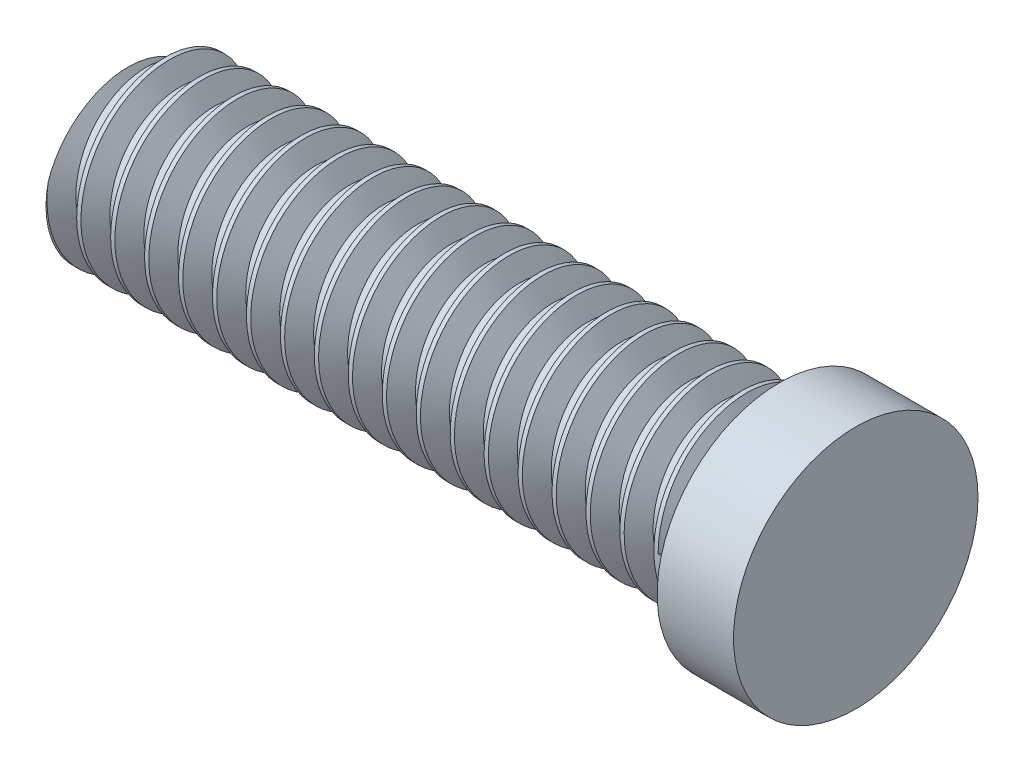
from build123d import *
from build123d.topology import SkipClean

# Parameters (mm, degrees)
SKETCH1_R           = 1.905
BOSS_EXTRUDE1_DEPTH = 13.335
SKETCH2_R           = 2.54
BOSS_EXTRUDE2_DEPTH = 1.5875
THREAD1_PITCH       = 0.705555556


with BuildPart() as part:
    # Sketch1 → Boss-Extrude1 (new body)
    with BuildSketch(Plane(origin=(0, 0, 0), x_dir=(0, 0, -1), z_dir=(1, 0, 0))):
        Circle(SKETCH1_R)
    extrude(amount=BOSS_EXTRUDE1_DEPTH)

    # Sketch2 → Boss-Extrude2 (add)
    with BuildSketch(Plane(origin=(13.335, 0, 0), x_dir=(0, 0, -1), z_dir=(1, 0, 0))):
        Circle(SKETCH2_R)
    extrude(amount=BOSS_EXTRUDE2_DEPTH)

    # Thread1: the profile of Thread Profile1 profile screwed along a right-hand helix of 21.6 turns, 6 arcs to a turn; built about Z, then put on its axis
    with SkipClean():  # the faces are left unmerged after this step: merging them gives an invalid solid
        thread1_z = Axis((0, 0, 0), (0, 0, 1))
        thread1_corners = [(1.9053, 0, -0.000173205), (1.9053, 0, 0.617534314), (1.523106855, 0, 0.396874999), (1.523106855, 0, 0.22048611)]
        with BuildLine(mode=Mode.PRIVATE) as thread1_profile:
            Line(thread1_corners[0], thread1_corners[1])
            Line(thread1_corners[1], thread1_corners[2])
            Line(thread1_corners[2], thread1_corners[3])
            Line(thread1_corners[3], thread1_corners[0])
        thread1_cap = Face(thread1_profile.wire())
        thread1_turn_angles = [0, 30, 60, 90, 120, 150, 180, 210, 240, 270, 300, 330, 360]
        thread1_turn_weights = [1, 0.8660254037844387, 1, 0.8660254037844387, 1, 0.8660254037844387, 1, 0.8660254037844387, 1, 0.8660254037844387, 1, 0.8660254037844387, 1]
        thread1_turn_rails = [Edge.make_bspline([Vector(p[0], p[1], 0).rotate(thread1_z, thread1_turn_angles[k]) / thread1_turn_weights[k] + Vector(0, 0, p[2] + THREAD1_PITCH * thread1_turn_angles[k] / 360) for k in range(13)], [0, 0, 0, 1, 1, 2, 2, 3, 3, 4, 4, 5, 5, 6, 6, 6], 2, thread1_turn_weights) for p in thread1_corners]
        thread1_turn_sides = [Face.make_surface_from_curves(thread1_turn_rails[p[0]], thread1_turn_rails[p[1]]) for p in [(0, 1), (1, 2), (2, 3), (3, 0)]]
        thread1_last_angles = [7560, 7590, 7620, 7650, 7680, 7710, 7740, 7758, 7776]
        thread1_last_weights = [1, 0.8660254037844387, 1, 0.8660254037844387, 1, 0.8660254037844387, 1, 0.9510565162951535, 1]
        thread1_last_rails = [Edge.make_bspline([Vector(p[0], p[1], 0).rotate(thread1_z, thread1_last_angles[k]) / thread1_last_weights[k] + Vector(0, 0, p[2] + THREAD1_PITCH * thread1_last_angles[k] / 360) for k in range(9)], [0, 0, 0, 1, 1, 2, 2, 3, 3, 4, 4, 4], 2, thread1_last_weights) for p in thread1_corners]
        thread1_last_sides = [Face.make_surface_from_curves(thread1_last_rails[p[0]], thread1_last_rails[p[1]]) for p in [(0, 1), (1, 2), (2, 3), (3, 0)]]
        thread1 = Plane(origin=(13.335, 0, 0), x_dir=(0, 0.052335956, 0.998629535), z_dir=(-1, 0, 0)) * Solid(Shell([*[p.moved(Location((0, 0, THREAD1_PITCH * i))) for i in range(21) for p in thread1_turn_sides], *thread1_last_sides, thread1_cap, thread1_cap.rotate(thread1_z, 7776).moved(Location((0, 0, THREAD1_PITCH * 7776 / 360)))]))
        add(thread1, mode=Mode.SUBTRACT)


solid = part.part
